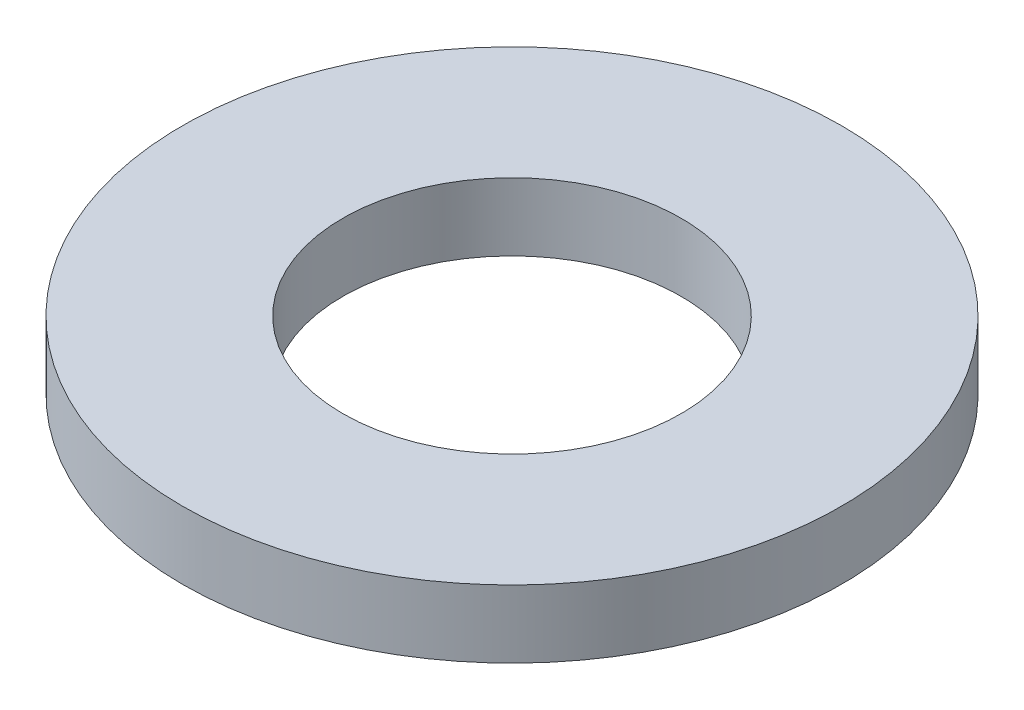
from build123d import *

# Parameters (mm, degrees)
SKETCH1_R           = 92.5
BOSS_EXTRUDE1_DEPTH = 19
SKETCH2_R           = 47.5
CUT_EXTRUDE1_DEPTH  = 133.187367021


with BuildPart() as part:
    # Sketch1 → Boss-Extrude1 (new body)
    with BuildSketch(Plane(origin=(0, 0, 0), x_dir=(1, 0, 0), z_dir=(0, 1, 0))):
        Circle(SKETCH1_R)
    extrude(amount=BOSS_EXTRUDE1_DEPTH)

    # Sketch2 → Cut-Extrude1 (cut, through all)
    with BuildSketch(Plane(origin=(0, 0, 0), x_dir=(1, 0, 0), z_dir=(0, 1, 0))):
        Circle(SKETCH2_R)
    extrude(amount=CUT_EXTRUDE1_DEPTH, mode=Mode.SUBTRACT)


solid = part.part
